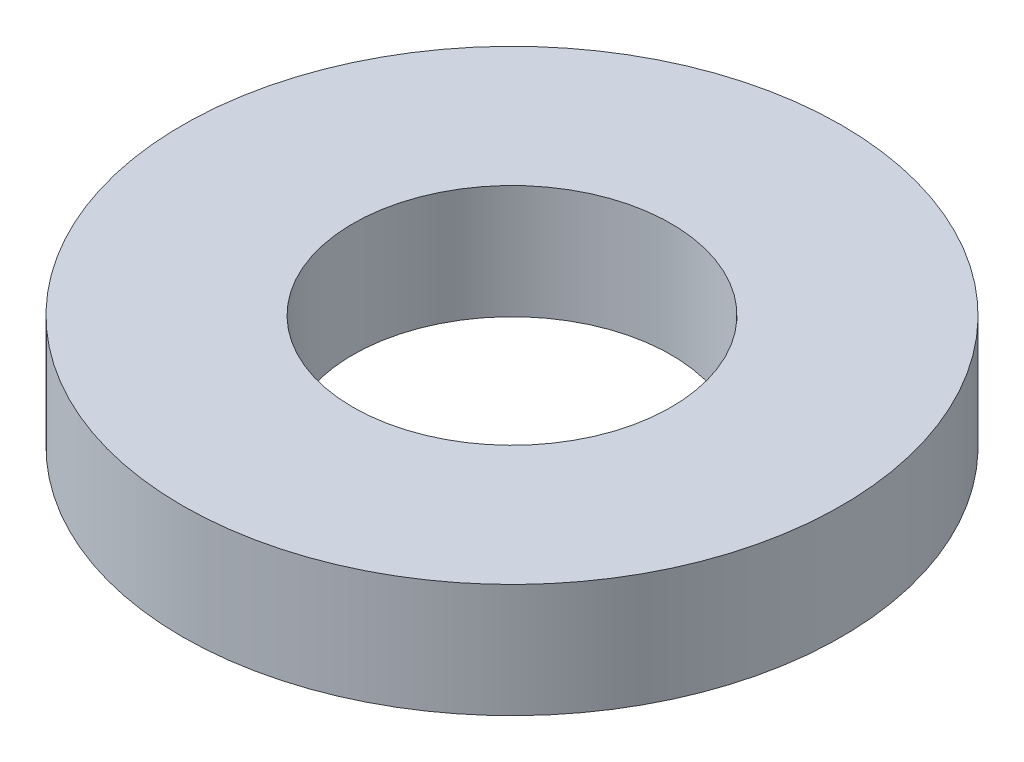
from build123d import *

# Parameters (mm, degrees)
SKETCH1_R           = 72.5
BOSS_EXTRUDE1_DEPTH = 25
SKETCH2_R           = 35
CUT_EXTRUDE1_DEPTH  = 106.534354596


with BuildPart() as part:
    # Sketch1 → Boss-Extrude1 (new body)
    with BuildSketch(Plane(origin=(0, 0, 0), x_dir=(1, 0, 0), z_dir=(0, 1, 0))):
        Circle(SKETCH1_R)
    extrude(amount=BOSS_EXTRUDE1_DEPTH)

    # Sketch2 → Cut-Extrude1 (cut, through all)
    with BuildSketch(Plane(origin=(0, 0, 0), x_dir=(1, 0, 0), z_dir=(0, 1, 0))):
        Circle(SKETCH2_R)
    extrude(amount=CUT_EXTRUDE1_DEPTH, mode=Mode.SUBTRACT)


solid = part.part
